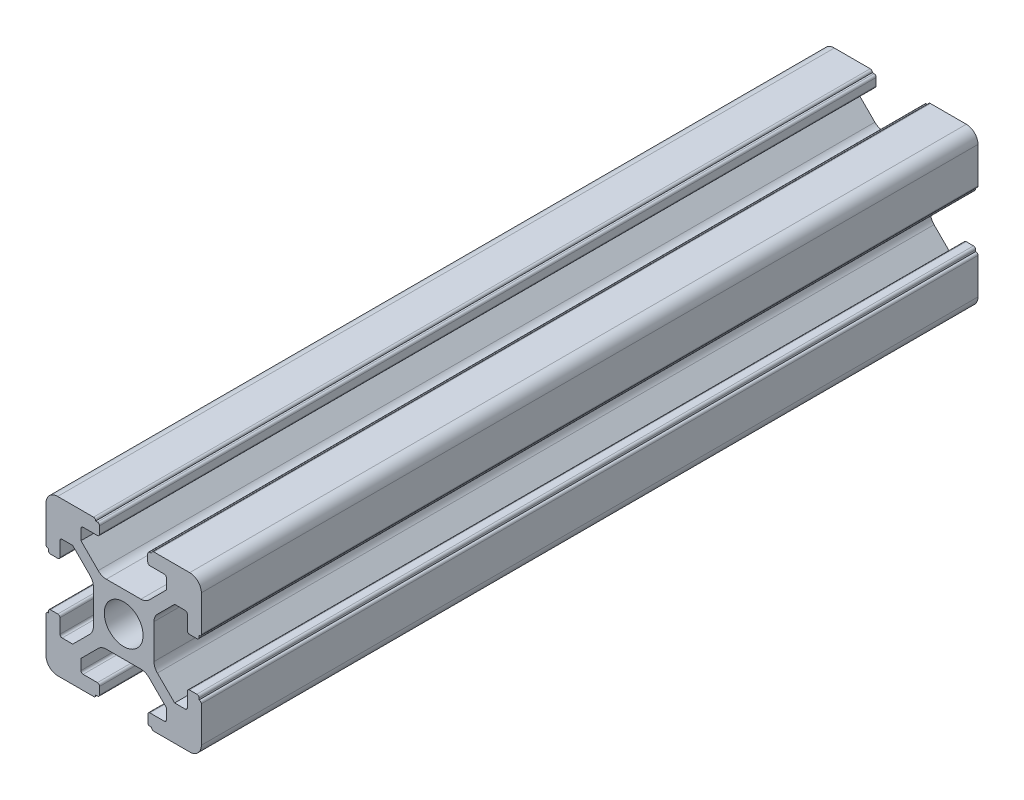
from build123d import *

# Parameters (mm, degrees)
BOSS_EXTRUDE1_DEPTH = 100
F_3DSKETCH2_R       = 2.5
CUT_EXTRUDE1_DEPTH  = 101.995386404


with BuildPart() as part:
    # Sketch1 → Boss-Extrude1 (new body)
    with BuildSketch(Plane.XY):
        with BuildLine():
            ThreePointArc((-4.339541497, 3.27832502), (-4.01438237, 2.791689997), (-3.900201668, 2.217664848))
            Line((-3.900201668, 2.217664848), (-3.900201668, -2.220777458))
            ThreePointArc((-3.900201668, -2.220777458), (-4.013982246, -2.793835668), (-4.338062619, -3.279956687))
            ThreePointArc((-4.338062619, -3.279956687), (-4.338801799, -3.280697416), (-4.339541497, -3.28143763))
            Line((-4.339541497, -3.28143763), (-6.559305445, -5.501201578))
            Line((-6.559305445, -5.501201578), (-7.918645273, -5.501201578))
            ThreePointArc((-7.918645273, -5.501201578), (-8.116635172, -5.419191476), (-8.198645273, -5.221201578))
            Line((-8.198645273, -5.221201578), (-8.198645273, -3.381201578))
            ThreePointArc((-8.198645273, -3.381201578), (-8.280655374, -3.183211679), (-8.478645273, -3.101201578))
            Line((-8.478645273, -3.101201578), (-9.418645273, -3.101201578))
            ThreePointArc((-9.418645273, -3.101201578), (-9.616635172, -3.183211679), (-9.698645273, -3.381201578))
            Line((-9.698645273, -3.381201578), (-9.698645273, -3.601201578))
            Line((-9.698645273, -3.601201578), (-9.718645273, -3.601201578))
            ThreePointArc((-9.718645273, -3.601201578), (-9.916635172, -3.683211679), (-9.998645273, -3.881201578))
            Line((-9.998645273, -3.881201578), (-9.998645273, -8.501201578))
            ThreePointArc((-9.998645273, -8.501201578), (-9.559305445, -9.561861749), (-8.498645273, -10.001201578))
            Line((-8.498645273, -10.001201578), (-3.878645273, -10.001201578))
            ThreePointArc((-3.878645273, -10.001201578), (-3.680655374, -9.919191476), (-3.598645273, -9.721201578))
            Line((-3.598645273, -9.721201578), (-3.598645273, -9.701201578))
            Line((-3.598645273, -9.701201578), (-3.378645273, -9.701201578))
            ThreePointArc((-3.378645273, -9.701201578), (-3.180655374, -9.619191476), (-3.098645273, -9.421201578))
            Line((-3.098645273, -9.421201578), (-3.098645273, -8.481201578))
            ThreePointArc((-3.098645273, -8.481201578), (-3.180655374, -8.283211679), (-3.378645273, -8.201201578))
            Line((-3.378645273, -8.201201578), (-5.218645273, -8.201201578))
            ThreePointArc((-5.218645273, -8.201201578), (-5.416635172, -8.119191476), (-5.498645273, -7.921201578))
            Line((-5.498645273, -7.921201578), (-5.498645273, -6.561861749))
            Line((-5.498645273, -6.561861749), (-3.277324929, -4.340541406))
            ThreePointArc((-3.277324929, -4.340541406), (-2.790689906, -4.015382279), (-2.216664757, -3.901201578))
            Line((-2.216664757, -3.901201578), (2.234977304, -3.899793498))
            ThreePointArc((2.234977304, -3.899793498), (2.801097117, -4.016727825), (3.280957809, -4.339061494))
            Line((3.280957809, -4.339061494), (5.502201668, -6.560305354))
            Line((5.502201668, -6.560305354), (5.502201668, -7.919645182))
            ThreePointArc((5.502201668, -7.919645182), (5.420191567, -8.117635081), (5.222201668, -8.199645182))
            Line((5.222201668, -8.199645182), (3.382201668, -8.199645182))
            ThreePointArc((3.382201668, -8.199645182), (3.18421177, -8.281655283), (3.102201668, -8.479645182))
            Line((3.102201668, -8.479645182), (3.102201668, -9.419645182))
            ThreePointArc((3.102201668, -9.419645182), (3.18421177, -9.617635081), (3.382201668, -9.699645182))
            Line((3.382201668, -9.699645182), (3.602201668, -9.699645182))
            Line((3.602201668, -9.699645182), (3.602201668, -9.719645182))
            ThreePointArc((3.602201668, -9.719645182), (3.68421177, -9.917635081), (3.882201668, -9.999645182))
            Line((3.882201668, -9.999645182), (8.502201668, -9.999645182))
            ThreePointArc((8.502201668, -9.999645182), (9.56286184, -9.560305354), (10.002201668, -8.499645182))
            Line((10.002201668, -8.499645182), (10.002201668, -3.879645182))
            ThreePointArc((10.002201668, -3.879645182), (9.920191567, -3.681655283), (9.722201668, -3.599645182))
            Line((9.722201668, -3.599645182), (9.702201668, -3.599645182))
            Line((9.702201668, -3.599645182), (9.702201668, -3.379645182))
            ThreePointArc((9.702201668, -3.379645182), (9.620191567, -3.181655283), (9.422201668, -3.099645182))
            Line((9.422201668, -3.099645182), (8.482201668, -3.099645182))
            ThreePointArc((8.482201668, -3.099645182), (8.28421177, -3.181655283), (8.202201668, -3.379645182))
            Line((8.202201668, -3.379645182), (8.202201668, -5.219645182))
            ThreePointArc((8.202201668, -5.219645182), (8.120191567, -5.417635081), (7.922201668, -5.499645182))
            Line((7.922201668, -5.499645182), (6.56286184, -5.499645182))
            Line((6.56286184, -5.499645182), (4.341541497, -3.278324838))
            ThreePointArc((4.341541497, -3.278324838), (4.01638237, -2.791689815), (3.902201668, -2.217664667))
            Line((3.902201668, -2.217664667), (3.900793589, 2.233977395))
            ThreePointArc((3.900793589, 2.233977395), (4.017727916, 2.800097207), (4.340061585, 3.2799579))
            Line((4.340061585, 3.2799579), (6.561305445, 5.501201759))
            Line((6.561305445, 5.501201759), (7.920645273, 5.501201759))
            ThreePointArc((7.920645273, 5.501201759), (8.118635172, 5.419191658), (8.200645273, 5.221201759))
            Line((8.200645273, 5.221201759), (8.200645273, 3.381201759))
            ThreePointArc((8.200645273, 3.381201759), (8.282655374, 3.183211861), (8.480645273, 3.101201759))
            Line((8.480645273, 3.101201759), (9.420645273, 3.101201759))
            ThreePointArc((9.420645273, 3.101201759), (9.618635172, 3.183211861), (9.700645273, 3.381201759))
            Line((9.700645273, 3.381201759), (9.700645273, 3.601201759))
            Line((9.700645273, 3.601201759), (9.720645273, 3.601201759))
            ThreePointArc((9.720645273, 3.601201759), (9.918635172, 3.683211861), (10.000645273, 3.881201759))
            Line((10.000645273, 3.881201759), (10.000645273, 8.501201759))
            ThreePointArc((10.000645273, 8.501201759), (9.561305445, 9.561861931), (8.500645273, 10.001201759))
            Line((8.500645273, 10.001201759), (3.880645273, 10.001201759))
            ThreePointArc((3.880645273, 10.001201759), (3.682655374, 9.919191658), (3.600645273, 9.721201759))
            Line((3.600645273, 9.721201759), (3.600645273, 9.701201759))
            Line((3.600645273, 9.701201759), (3.380645273, 9.701201759))
            ThreePointArc((3.380645273, 9.701201759), (3.182655374, 9.619191658), (3.100645273, 9.421201759))
            Line((3.100645273, 9.421201759), (3.100645273, 8.481201759))
            ThreePointArc((3.100645273, 8.481201759), (3.182655374, 8.283211861), (3.380645273, 8.201201759))
            Line((3.380645273, 8.201201759), (5.220645273, 8.201201759))
            ThreePointArc((5.220645273, 8.201201759), (5.418635172, 8.119191658), (5.500645273, 7.921201759))
            Line((5.500645273, 7.921201759), (5.500645273, 6.561861931))
            Line((5.500645273, 6.561861931), (3.279324929, 4.340541588))
            ThreePointArc((3.279324929, 4.340541588), (2.792689906, 4.015382461), (2.218664757, 3.901201759))
            Line((2.218664757, 3.901201759), (-2.232977304, 3.89979368))
            ThreePointArc((-2.232977304, 3.89979368), (-2.799097117, 4.016728006), (-3.278957809, 4.339061676))
            Line((-3.278957809, 4.339061676), (-5.500201668, 6.560305535))
            Line((-5.500201668, 6.560305535), (-5.500201668, 7.919645364))
            ThreePointArc((-5.500201668, 7.919645364), (-5.418191567, 8.117635262), (-5.220201668, 8.199645364))
            Line((-5.220201668, 8.199645364), (-3.380201668, 8.199645364))
            ThreePointArc((-3.380201668, 8.199645364), (-3.18221177, 8.281655465), (-3.100201668, 8.479645364))
            Line((-3.100201668, 8.479645364), (-3.100201668, 9.419645364))
            ThreePointArc((-3.100201668, 9.419645364), (-3.18221177, 9.617635262), (-3.380201668, 9.699645364))
            Line((-3.380201668, 9.699645364), (-3.600201668, 9.699645364))
            Line((-3.600201668, 9.699645364), (-3.600201668, 9.719645364))
            ThreePointArc((-3.600201668, 9.719645364), (-3.68221177, 9.917635262), (-3.880201668, 9.999645364))
            Line((-3.880201668, 9.999645364), (-8.500201668, 9.999645364))
            ThreePointArc((-8.500201668, 9.999645364), (-9.56086184, 9.560305535), (-10.000201668, 8.499645364))
            Line((-10.000201668, 8.499645364), (-10.000201668, 3.879645364))
            ThreePointArc((-10.000201668, 3.879645364), (-9.918191567, 3.681655465), (-9.720201668, 3.599645364))
            Line((-9.720201668, 3.599645364), (-9.700201668, 3.599645364))
            Line((-9.700201668, 3.599645364), (-9.700201668, 3.379645364))
            ThreePointArc((-9.700201668, 3.379645364), (-9.618191567, 3.181655465), (-9.420201668, 3.099645364))
            Line((-9.420201668, 3.099645364), (-8.480201668, 3.099645364))
            ThreePointArc((-8.480201668, 3.099645364), (-8.28221177, 3.181655465), (-8.200201668, 3.379645364))
            Line((-8.200201668, 3.379645364), (-8.200201668, 5.219645364))
            ThreePointArc((-8.200201668, 5.219645364), (-8.118191567, 5.417635262), (-7.920201668, 5.499645364))
            Line((-7.920201668, 5.499645364), (-6.56086184, 5.499645364))
            Line((-6.56086184, 5.499645364), (-4.339541497, 3.27832502))
        make_face()
    extrude(amount=BOSS_EXTRUDE1_DEPTH)

    # 3DSketch2 → Cut-Extrude1 (cut, through all)
    with BuildSketch(Plane.XY):
        Circle(F_3DSKETCH2_R)
    extrude(amount=CUT_EXTRUDE1_DEPTH, mode=Mode.SUBTRACT)


solid = part.part
